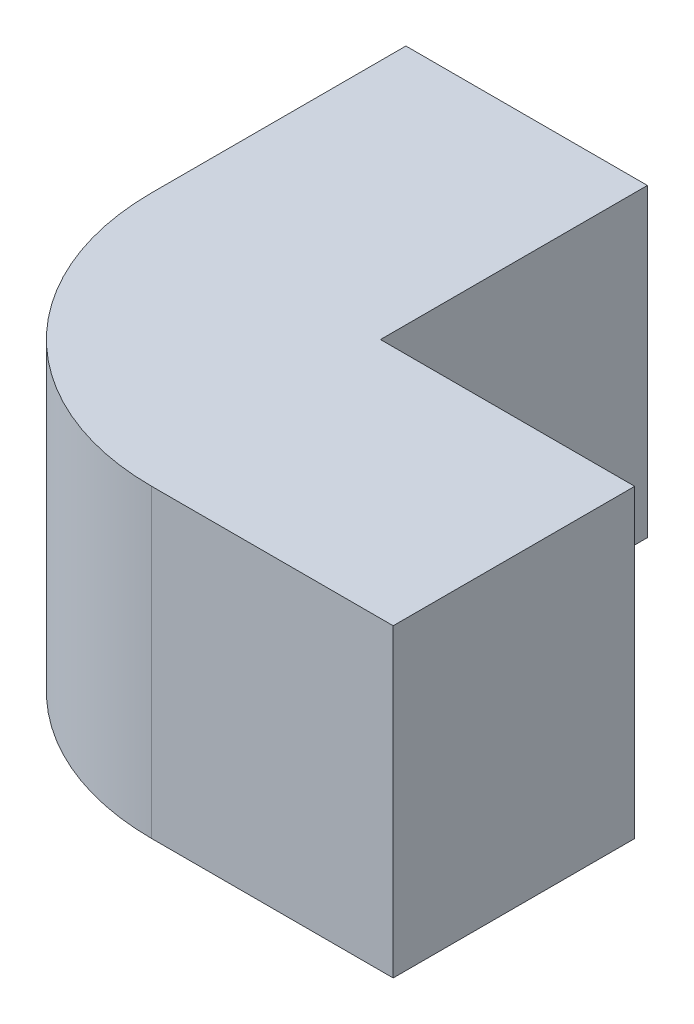
from build123d import *

# Parameters (mm, degrees)
SKETCH_1_W      = 3.8
SKETCH_1_H      = 4.8
EXTRUDE_1_DEPTH = 8
SKETCH_2_W      = 3.8
SKETCH_2_H      = 4.8
EXTRUDE_2_DEPTH = 4
FILLET_2_R      = 4


with BuildPart() as part:
    # 草图1 → 凸台-拉伸1 (new body)
    with BuildSketch(Plane.XY):
        with Locations((1.9, -2.4)):
            Rectangle(SKETCH_1_W, SKETCH_1_H)
    extrude(amount=EXTRUDE_1_DEPTH)

    # 草图2 → 凸台-拉伸2 (add)
    with BuildSketch(Plane(origin=(3.8, 0, 0), x_dir=(0, 0, -1), z_dir=(1, 0, 0))):
        with Locations((-6.1, -2.4)):
            Rectangle(SKETCH_2_W, SKETCH_2_H)
    extrude(amount=EXTRUDE_2_DEPTH)

    # 圆角2
    fillet_2_edges = [part.edges().sort_by_distance(p)[0] for p in [
        (0, -2.4, 8),
    ]]
    fillet(fillet_2_edges, radius=FILLET_2_R)


solid = part.part
